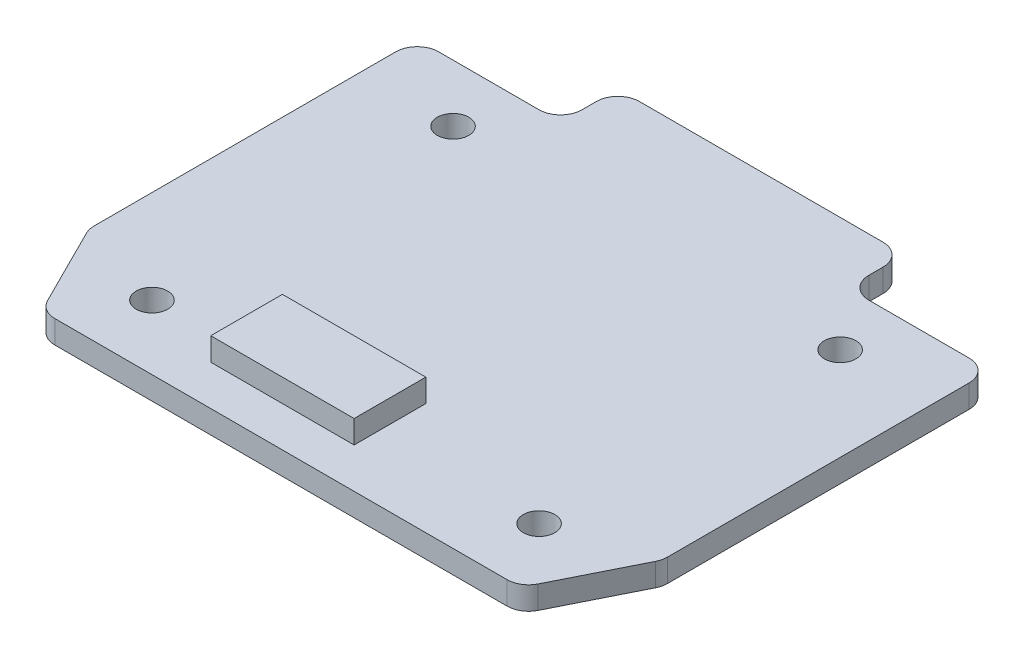
from build123d import *

# Parameters (mm, degrees)
BOSS_EXTRUDE1_DEPTH      = 1.6
CUT_EXTRUDE4_DEPTH       = 28.461290938
M2_CLEARANCE_HOLE1_D     = 2.2
M2_CLEARANCE_HOLE1_DEPTH = 5.2
M2_CLEARANCE_HOLE1_TIP   = 0.660946681
SKETCH11_W               = 30
SKETCH11_H               = 28.944863729
SKETCH11_R               = 1
CUT_EXTRUDE3_DEPTH       = 0.001
SKETCH13_W               = 10
SKETCH13_H               = 5
BOSS_EXTRUDE2_DEPTH      = 1.6
FILLET1_R                = 1.5


with BuildPart() as part:
    # Sketch1 → Boss-Extrude1 (new body)
    with BuildSketch(Plane(origin=(0, 0, 0), x_dir=(1, 0, 0), z_dir=(0, 1, 0))):
        Polygon((-20, 14.75), (-10, 14.75), (-10, 18.75), (10, 18.75), (10, 14.75), (20, 14.75), (20, -14.75), (-20, -14.75), align=None)
    extrude(amount=BOSS_EXTRUDE1_DEPTH)

    # Sketch12 → Cut-Extrude4 (cut, through all)
    with BuildSketch(Plane(origin=(0, 1.6, 0), x_dir=(1, 0, 0), z_dir=(0, 1, 0))):
        Polygon((-16.7, -14.75), (-20, -8.15), (-20, -14.75), align=None)
        Polygon((16.7, -14.75), (20, -8.15), (20, -14.75), align=None)
    extrude(amount=-CUT_EXTRUDE4_DEPTH, mode=Mode.SUBTRACT)

    # M2 Clearance Hole1
    with Locations(Plane(origin=(0, 1.6, 0), x_dir=(1, 0, 0), z_dir=(0, 1, 0))):
        with Locations((-13.5, 10.75), (13.5, 10.75), (13.5, -10.25), (-13.5, -10.25)):
            Hole(M2_CLEARANCE_HOLE1_D / 2, depth=M2_CLEARANCE_HOLE1_DEPTH)
            with Locations((0, 0, -(M2_CLEARANCE_HOLE1_DEPTH + M2_CLEARANCE_HOLE1_TIP / 2))):  # 118° drill point
                Cone(0, M2_CLEARANCE_HOLE1_D / 2, M2_CLEARANCE_HOLE1_TIP, mode=Mode.SUBTRACT)

    # Sketch11 → Cut-Extrude3 (cut)
    with BuildSketch(Plane.XZ):
        with Locations((0, -0.277568136)):
            Rectangle(SKETCH11_W, SKETCH11_H)
        with Locations((13.5, -12.75)):
            Circle(SKETCH11_R, mode=Mode.SUBTRACT)
        with Locations((13.5, 10.25)):
            Circle(SKETCH11_R, mode=Mode.SUBTRACT)
        with Locations((-13.5, -12.75)):
            Circle(SKETCH11_R, mode=Mode.SUBTRACT)
        with Locations((-13.5, 10.25)):
            Circle(SKETCH11_R, mode=Mode.SUBTRACT)
        with BuildLine():
            Line((-10, 11.694863729), (10, 11.694863729))
            ThreePointArc((10, 11.694863729), (11.434632325, 11.088706998), (12, 9.637516011))
            Line((12, 9.637516011), (12, -9.74800182))
            add(Edge.make_bspline(
                [(10, -11.748801092), (12, -11.748801092), (12, -9.74800182)],
                knots=[3.141592654, 3.141592654, 3.141592654, 4.71238898, 4.71238898, 4.71238898], degree=2, weights=[1, 0.707106781, 1]))
            Line((10, -11.748801092), (-10, -11.748801092))
            add(Edge.make_bspline(
                [(-12, -9.74800182), (-12, -11.748801092), (-10, -11.748801092)],
                knots=[1.570796327, 1.570796327, 1.570796327, 3.141592654, 3.141592654, 3.141592654], degree=2, weights=[1, 0.707106781, 1]))
            Line((-12, -9.74800182), (-12, 9.750612903))
            ThreePointArc((-12, 9.750612903), (-11.394642541, 11.128696782), (-10, 11.694863729))
        make_face(mode=Mode.SUBTRACT)
    extrude(amount=-CUT_EXTRUDE3_DEPTH, mode=Mode.SUBTRACT)

    # Fillet1
    fillet1_edges = [part.edges().sort_by_distance(p)[0] for p in [
        (-20, 0.8, -14.75),
        (20, 0.8, 8.15),
        (16.7, 0.8, 14.75),
        (-16.7, 0.8, 14.75),
        (-20, 0.8, 8.15),
        (20, 0.8, -14.75),
        (10, 0.8, -18.75),
        (10, 0.8005, -14.75),
        (-10, 0.8, -18.75),
        (-10, 0.8005, -14.75),
    ]]
    fillet(fillet1_edges, radius=FILLET1_R)


with BuildPart() as body_2:
    # Sketch13 → Boss-Extrude2 (new body)
    with BuildSketch(Plane(origin=(0, 1.6, 0), x_dir=(1, 0, 0), z_dir=(0, 1, 0))):
        with Locations((-2.7, -9.45)):
            Rectangle(SKETCH13_W, SKETCH13_H)
    extrude(amount=BOSS_EXTRUDE2_DEPTH)


solid = Compound([part.part, body_2.part])
